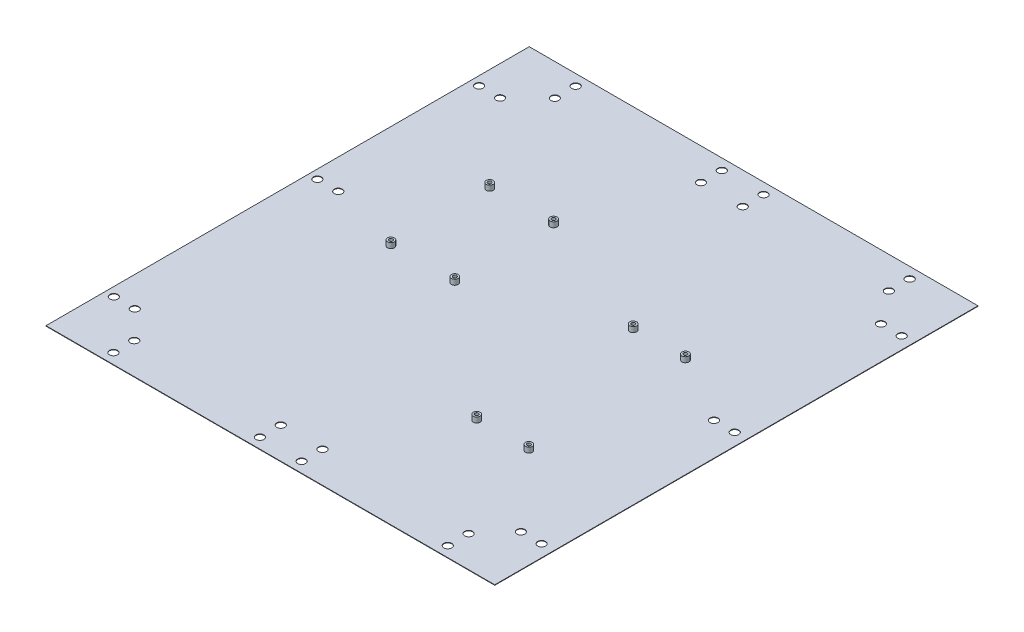
from build123d import *

# Parameters (mm, degrees)
SKETCH1_W           = 430
SKETCH1_H           = 463
BOSS_EXTRUDE1_DEPTH = 0.45
SKETCH7_R           = 3.3
BOSS_EXTRUDE2_DEPTH = 5
SKETCH8_R           = 1.75
CUT_EXTRUDE1_DEPTH  = 4
SKETCH6_R           = 3.3
BOSS_EXTRUDE3_DEPTH = 5
SKETCH10_R          = 1.75
CUT_EXTRUDE2_DEPTH  = 4
SKETCH12_R          = 3.8
CUT_EXTRUDE3_DEPTH  = 10


with BuildPart() as part:
    # Sketch1 → Boss-Extrude1 (new body)
    with BuildSketch(Plane(origin=(0, 0, 0), x_dir=(1, 0, 0), z_dir=(0, 1, 0))):
        Rectangle(SKETCH1_W, SKETCH1_H)
    extrude(amount=BOSS_EXTRUDE1_DEPTH)

    # Sketch7 → Boss-Extrude2 (add)
    with BuildSketch(Plane(origin=(0, 0.45, 0), x_dir=(1, 0, 0), z_dir=(0, 1, 0))):
        with Locations((-116.362714529, 94.945868521)):
            Circle(SKETCH7_R)
        with Locations((-55.363204635, 95.191638193)):
            Circle(SKETCH7_R)
        with Locations((-54.980448566, 0.192396061)):
            Circle(SKETCH7_R)
        with Locations((-115.97995846, -0.053373612)):
            Circle(SKETCH7_R)
    extrude(amount=BOSS_EXTRUDE2_DEPTH)

    # Sketch8 → Cut-Extrude1 (cut)
    with BuildSketch(Plane(origin=(0, 5.45, 0), x_dir=(1, 0, 0), z_dir=(0, 1, 0))):
        with Locations((-54.980448566, 0.192396061)):
            Circle(SKETCH8_R)
        with Locations((-55.363204635, 95.191638193)):
            Circle(SKETCH8_R)
        with Locations((-116.362714529, 94.945868521)):
            Circle(SKETCH8_R)
        with Locations((-115.97995846, -0.053373612)):
            Circle(SKETCH8_R)
    extrude(amount=-CUT_EXTRUDE1_DEPTH, mode=Mode.SUBTRACT)

    # Sketch6 → Boss-Extrude3 (add)
    with BuildSketch(Plane(origin=(0, 0.45, 0), x_dir=(1, 0, 0), z_dir=(0, 1, 0))):
        with Locations((119.793345796, 46.373061352)):
            Circle(SKETCH6_R)
        with Locations((69.793345796, 46.373061352)):
            Circle(SKETCH6_R)
        with Locations((119.793345796, -103.626938648)):
            Circle(SKETCH6_R)
        with Locations((69.793345796, -103.626938648)):
            Circle(SKETCH6_R)
    extrude(amount=BOSS_EXTRUDE3_DEPTH)

    # Sketch10 → Cut-Extrude2 (cut)
    with BuildSketch(Plane(origin=(0, 5.45, 0), x_dir=(1, 0, 0), z_dir=(0, 1, 0))):
        with Locations((69.793345796, 46.373061352)):
            Circle(SKETCH10_R)
        with Locations((119.793345796, 46.373061352)):
            Circle(SKETCH10_R)
        with Locations((119.793345796, -103.626938648)):
            Circle(SKETCH10_R)
        with Locations((69.793345796, -103.626938648)):
            Circle(SKETCH10_R)
    extrude(amount=-CUT_EXTRUDE2_DEPTH, mode=Mode.SUBTRACT)

    # Sketch12 → Cut-Extrude3 (cut)
    with BuildSketch(Plane(origin=(0, 0, 0), x_dir=(-1, 0, 0), z_dir=(0, -1, 0))):
        with Locations((-183.528683765, -175)):
            Circle(SKETCH12_R)
        with Locations((-203.398904111, 170)):
            Circle(SKETCH12_R)
        with Locations((-183.528683765, 10)):
            Circle(SKETCH12_R)
        with Locations((-203.398904111, 10)):
            Circle(SKETCH12_R)
        with Locations((-203.398904111, -175)):
            Circle(SKETCH12_R)
        with Locations((-183.528683765, 170)):
            Circle(SKETCH12_R)
        with Locations((206.525269648, -175)):
            Circle(SKETCH12_R)
        with Locations((206.525269648, 20)):
            Circle(SKETCH12_R)
        with Locations((186.44692003, 175)):
            Circle(SKETCH12_R)
        with Locations((206.52526965, 175)):
            Circle(SKETCH12_R)
        with Locations((186.44692003, -175)):
            Circle(SKETCH12_R)
        with Locations((186.446920025, 20)):
            Circle(SKETCH12_R)
        with Locations((160.349922153, -221.520559324)):
            Circle(SKETCH12_R)
        with Locations((160.349922153, -201.54839577)):
            Circle(SKETCH12_R)
        with Locations((20, -221.520559324)):
            Circle(SKETCH12_R)
        with Locations((20, -201.548395767)):
            Circle(SKETCH12_R)
        with Locations((-20, -201.54839577)):
            Circle(SKETCH12_R)
        with Locations((-20, -221.52055932)):
            Circle(SKETCH12_R)
        with Locations((-160, -221.52055932)):
            Circle(SKETCH12_R)
        with Locations((-160, -201.54839577)):
            Circle(SKETCH12_R)
        with Locations((160, 201.06768193)):
            Circle(SKETCH12_R)
        with Locations((160, 221.0363788)):
            Circle(SKETCH12_R)
        with Locations((20, 201.06768193)):
            Circle(SKETCH12_R)
        with Locations((20, 221.0363788)):
            Circle(SKETCH12_R)
        with Locations((-20, 201.06768193)):
            Circle(SKETCH12_R)
        with Locations((-20, 221.0363788)):
            Circle(SKETCH12_R)
        with Locations((-160, 201.067681927)):
            Circle(SKETCH12_R)
        with Locations((-160, 221.036378797)):
            Circle(SKETCH12_R)
    extrude(amount=-CUT_EXTRUDE3_DEPTH, mode=Mode.SUBTRACT)


solid = part.part
